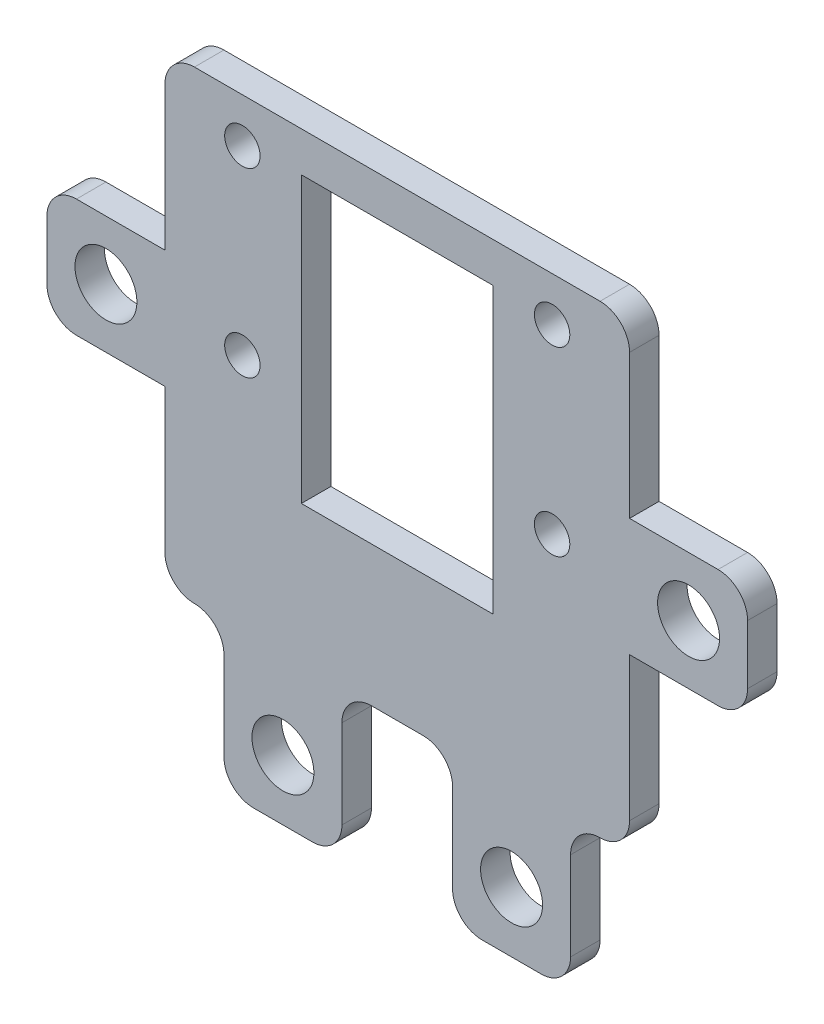
from build123d import *

# Parameters (mm, degrees)
SKETCH1_W             = 31.5
SKETCH1_H             = 31.5
SKETCH1_R             = 1.2
SKETCH1_W_2           = 13
SKETCH1_H_2           = 19.3
BOSS_EXTRUDE1_DEPTH   = 2
SKETCH4_W             = 8
SKETCH4_H             = 8
SKETCH4_R             = 2.1
BOSS_EXTRUDE3_DEPTH   = 2
CIRPATTERN2_OUTLINE_W = 8
CIRPATTERN2_OUTLINE_H = 8
CIRPATTERN2_OUTLINE_R = 2.1
CIRPATTERN2_DEPTH     = 2
SKETCH5_W             = 8
SKETCH5_H             = 10
SKETCH5_R             = 2.1
BOSS_EXTRUDE4_DEPTH   = 2
FILLET1_R             = 2


# Read off the part's stored shape, not the designer's step: CirPattern2
with BuildPart() as part:
    # Sketch1 → Boss-Extrude1 (new body)
    with BuildSketch(Plane.XY):
        with Locations((12.5, 9.25)):
            Rectangle(SKETCH1_W, SKETCH1_H)
        with Locations((2, 22)):
            Circle(SKETCH1_R, mode=Mode.SUBTRACT)
        with Locations((23, 22)):
            Circle(SKETCH1_R, mode=Mode.SUBTRACT)
        with Locations((23, 9.7)):
            Circle(SKETCH1_R, mode=Mode.SUBTRACT)
        with Locations((2, 9.7)):
            Circle(SKETCH1_R, mode=Mode.SUBTRACT)
        with Locations((12.5, 12.65)):
            Rectangle(SKETCH1_W_2, SKETCH1_H_2, mode=Mode.SUBTRACT)
    extrude(amount=BOSS_EXTRUDE1_DEPTH)

    # Sketch4 → Boss-Extrude3 (add)
    with BuildSketch(Plane.XY.offset(2)):
        with Locations((-7.25, 9.25)):
            Rectangle(SKETCH4_W, SKETCH4_H)
        with Locations((-7.25, 9.25)):
            Circle(SKETCH4_R, mode=Mode.SUBTRACT)
    extrude(amount=-BOSS_EXTRUDE3_DEPTH)

    # CirPattern2 outline → CirPattern2 (add)
    with BuildSketch(Plane.XY):
        with Locations((32.25, 9.25)):
            Rectangle(CIRPATTERN2_OUTLINE_W, CIRPATTERN2_OUTLINE_H)
        with Locations((32.25, 9.25)):
            Circle(CIRPATTERN2_OUTLINE_R, mode=Mode.SUBTRACT)
    extrude(amount=CIRPATTERN2_DEPTH)

    # Sketch5 → Boss-Extrude4 (add)
    # profile 1 of 2: a face of its own
    with BuildSketch(Plane(origin=(0, 0, 0), x_dir=(-1, 0, 0), z_dir=(0, 0, -1))):
        with Locations((-4.75, -11.5)):
            Rectangle(SKETCH5_W, SKETCH5_H)
        with Locations((-4.75, -12.4)):
            Circle(SKETCH5_R, mode=Mode.SUBTRACT)
    # profile 2 of 2: a face of its own
    with BuildSketch(Plane(origin=(0, 0, 0), x_dir=(-1, 0, 0), z_dir=(0, 0, -1))):
        with Locations((-20.25, -11.5)):
            Rectangle(SKETCH5_W, SKETCH5_H)
        with Locations(Location((-20.25, -12.4, 0), (0, 0, 180))):
            Circle(SKETCH5_R, mode=Mode.SUBTRACT)
    extrude(amount=-BOSS_EXTRUDE4_DEPTH)

    # Fillet1
    fillet1_edges = [part.edges().sort_by_distance(p)[0] for p in [
        (-11.25, 13.25, 1),
        (-11.25, 5.25, 1),
        (36.25, 5.25, 1),
        (36.25, 13.25, 1),
        (0.75, -6.5, 1),
        (0.75, -16.5, 1),
        (8.75, -16.5, 1),
        (8.75, -6.5, 1),
        (-3.25, 25, 1),
        (28.25, 25, 1),
        (28.25, -6.5, 1),
        (-3.25, -6.5, 1),
        (24.25, -16.5, 1),
        (24.25, -6.5, 1),
        (16.25, -6.5, 1),
        (16.25, -16.5, 1),
    ]]
    fillet(fillet1_edges, radius=FILLET1_R - 0.0001)  # a hair under: the kernel refuses the full size


solid = part.part
